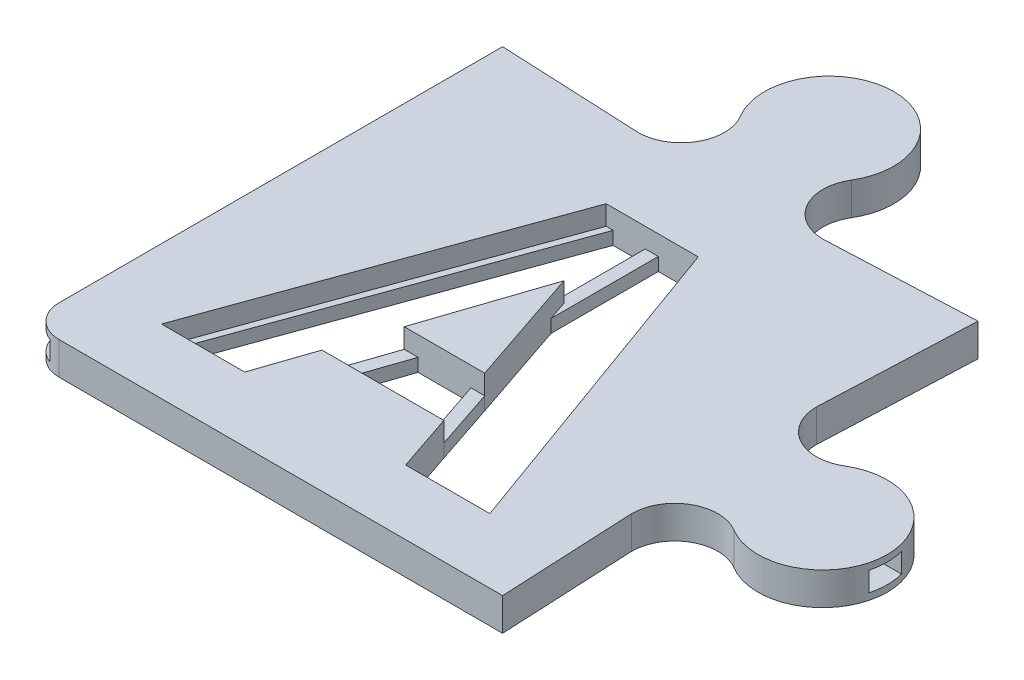
from build123d import *

# Parameters (mm, degrees)
BOSS_EXTRUDE1_DEPTH = 5
CUT_EXTRUDE1_DEPTH  = 3
CUT_EXTRUDE2_DEPTH  = 87.177839379
CUT_EXTRUDE3_START  = -1
SKETCH6_W           = 8
SKETCH6_H           = 34
CUT_EXTRUDE3_DEPTH  = 3
CUT_EXTRUDE4_REACH  = 88.271
SKETCH6_3_W         = 5
SKETCH6_3_H         = 27.5
CUT_EXTRUDE5_START  = -1
SKETCH8_W           = 5
SKETCH8_H           = 9
SKETCH8_W_2         = 9
SKETCH8_H_2         = 5
CUT_EXTRUDE5_DEPTH  = 3
CUT_EXTRUDE6_START  = -1
CUT_EXTRUDE6_DEPTH  = 3


with BuildPart() as part:
    # Sketch1 → Boss-Extrude1 (new body)
    with BuildSketch(Plane(origin=(0, 0, 0), x_dir=(1, 0, 0), z_dir=(0, 1, 0))):
        with BuildLine():
            Line((-35.9, 36.895320389), (-35.9, -31))
            ThreePointArc((-35.9, -31), (-34.464823228, -34.464823228), (-31, -35.9))
            Line((-31, -35.9), (36.895090782, -35.9))
            Line((36.895090782, -35.9), (35.900000438, -15.144540564))
            ThreePointArc((35.900000438, -15.144540564), (39.249338076, -9.398165128), (45.9, -9.485281374))
            ThreePointArc((45.9, -9.485281374), (60.9, -1), (45.9, 7.485281374))
            ThreePointArc((45.9, 7.485281374), (39.249469546, 7.398090728), (35.900000335, 13.144238441))
            Line((35.900000335, 13.144238441), (36.895525119, 36.895333717))
            Line((36.895525119, 36.895333717), (14.14433035, 35.900000365))
            ThreePointArc((14.14433035, 35.900000365), (8.398113361, 39.249429551), (8.485281374, 45.9))
            ThreePointArc((8.485281374, 45.9), (0, 60.9), (-8.485281374, 45.9))
            ThreePointArc((-8.485281374, 45.9), (-8.398138062, 39.249385903), (-14.144430656, 35.900000399))
            Line((-14.144430656, 35.900000399), (-35.9, 36.895320389))
        make_face()
    extrude(amount=BOSS_EXTRUDE1_DEPTH)

    # Sketch3 → Cut-Extrude1 (cut)
    with BuildSketch(Plane(origin=(0, 5, 0), x_dir=(1, 0, 0), z_dir=(0, 1, 0))):
        Polygon((9.161170651, -17.168590272), (-9.501236603, -17.168590272), (-12.489694971, -26), (-25.237015664, -26), (-7.151690025, 24), (6.955894477, 24), (25.041220115, -26), (12.149629019, -26), align=None)
        Polygon((6.02844188, -7.770403957), (-0.164880462, 10.541632317), (-6.29637263, -7.770403957), align=None, mode=Mode.SUBTRACT)
    extrude(amount=-CUT_EXTRUDE1_DEPTH, mode=Mode.SUBTRACT)

    # Sketch4 → Cut-Extrude2 (cut, through all)
    with BuildSketch(Plane(origin=(0, 2, 0), x_dir=(1, 0, 0), z_dir=(0, 1, 0))):
        Polygon((-6.29637263, -7.770403957), (-1.159863739, 7.57006041), (-1.159863739, 24), (-6.088284363, 24), (-24.173610002, -26), (-12.489694971, -26), (-9.501236603, -17.168590272), align=None)
        Polygon((0.840136261, 24), (0.840136261, 7.57006041), (6.02844188, -7.770403957), (9.161170651, -17.168590272), (12.149629019, -26), (23.977814454, -26), (5.892488815, 24), align=None)
        Polygon((3.920256773, -7.770403957), (-4.183282965, -7.770403957), (-7.388146939, -17.168590272), (7.052985544, -17.168590272), align=None)
    extrude(amount=-CUT_EXTRUDE2_DEPTH, mode=Mode.SUBTRACT)

    # Sketch6 → Cut-Extrude3 (cut)
    with BuildSketch(Plane.XZ.offset(CUT_EXTRUDE3_START)):
        with Locations((-31.9, 1.9)):
            Rectangle(SKETCH6_W, SKETCH6_H)
    extrude(amount=-CUT_EXTRUDE3_DEPTH, mode=Mode.SUBTRACT)

    # Sketch6<3> → Cut-Extrude4 (cut, up to next)
    with BuildSketch(Plane.XZ, mode=Mode.PRIVATE) as cut_extrude4_sk1:
        with Locations((-33.4, 1.9)):
            Rectangle(SKETCH6_3_W, SKETCH6_3_H)
    cut_extrude4_tool1 = extrude(cut_extrude4_sk1.sketch, amount=-CUT_EXTRUDE4_REACH, mode=Mode.PRIVATE) & part.part
    add(cut_extrude4_tool1.solids().sort_by_distance((-33.4, 0, 1.9))[0], mode=Mode.SUBTRACT)

    # Sketch8 → Cut-Extrude5 (cut)
    with BuildSketch(Plane.XZ.offset(CUT_EXTRUDE5_START)):
        with Locations((0, -56.4)):
            Rectangle(SKETCH8_W, SKETCH8_H)
        with Locations((56.4, 1)):
            Rectangle(SKETCH8_W_2, SKETCH8_H_2)
    extrude(amount=-CUT_EXTRUDE5_DEPTH, mode=Mode.SUBTRACT)

    # Sketch9 → Cut-Extrude6 (cut)
    with BuildSketch(Plane.XZ.offset(CUT_EXTRUDE6_START)):
        with BuildLine():
            Line((-35.849249703, 31.70340409), (-33.593075064, 30.108546018))
            ThreePointArc((-33.593075064, 30.108546018), (-30.108546018, 30.706924936), (-30.706924936, 34.191453982))
            Line((-30.706924936, 34.191453982), (-32.695651108, 35.597256499))
            ThreePointArc((-32.695651108, 35.597256499), (-34.807814768, 34.083917427), (-35.849249703, 31.70340409))
        make_face()
    extrude(amount=-CUT_EXTRUDE6_DEPTH, mode=Mode.SUBTRACT)


solid = part.part
